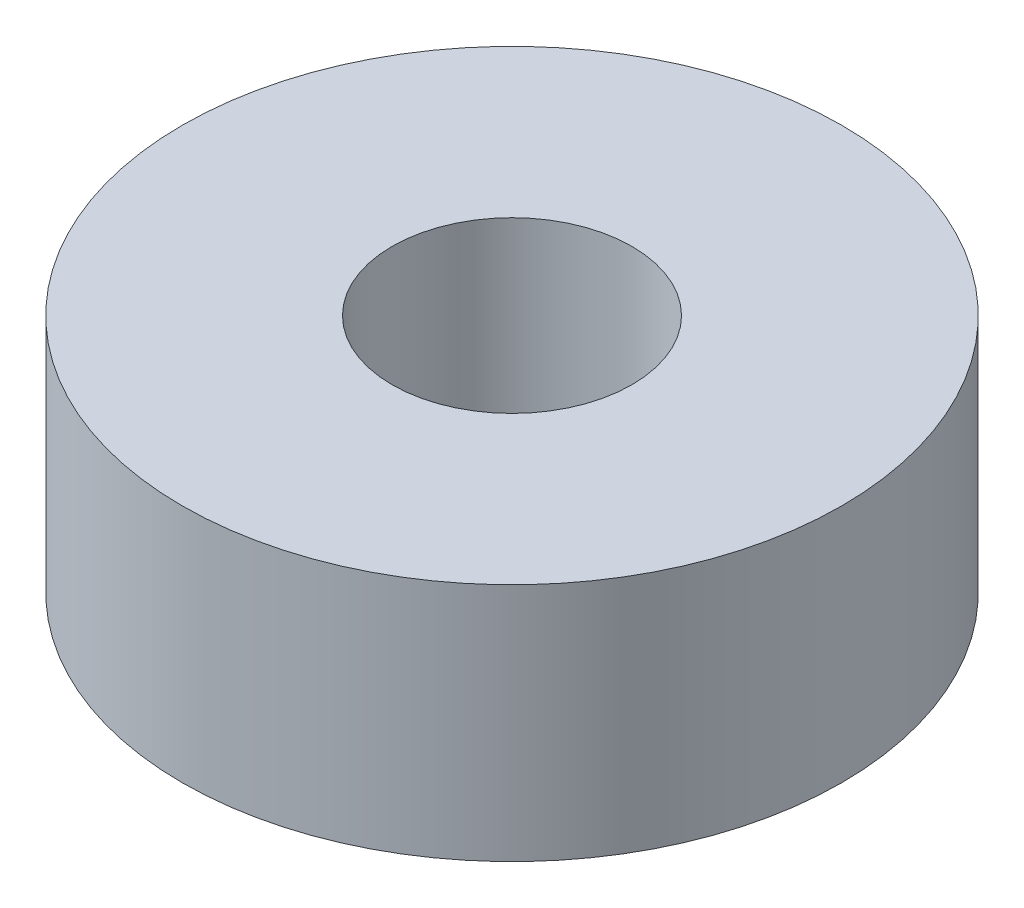
from build123d import *

# Parameters (mm, degrees)
SKETCH_1_R      = 5.5
SKETCH_1_R_2    = 2
EXTRUDE_1_DEPTH = 4


with BuildPart() as part:
    # Эскиз1 → Вытянуть1 (new body)
    with BuildSketch(Plane(origin=(0, 0, 0), x_dir=(1, 0, 0), z_dir=(0, 1, 0))):
        Circle(SKETCH_1_R)
        Circle(SKETCH_1_R_2, mode=Mode.SUBTRACT)
    extrude(amount=EXTRUDE_1_DEPTH)


solid = part.part
